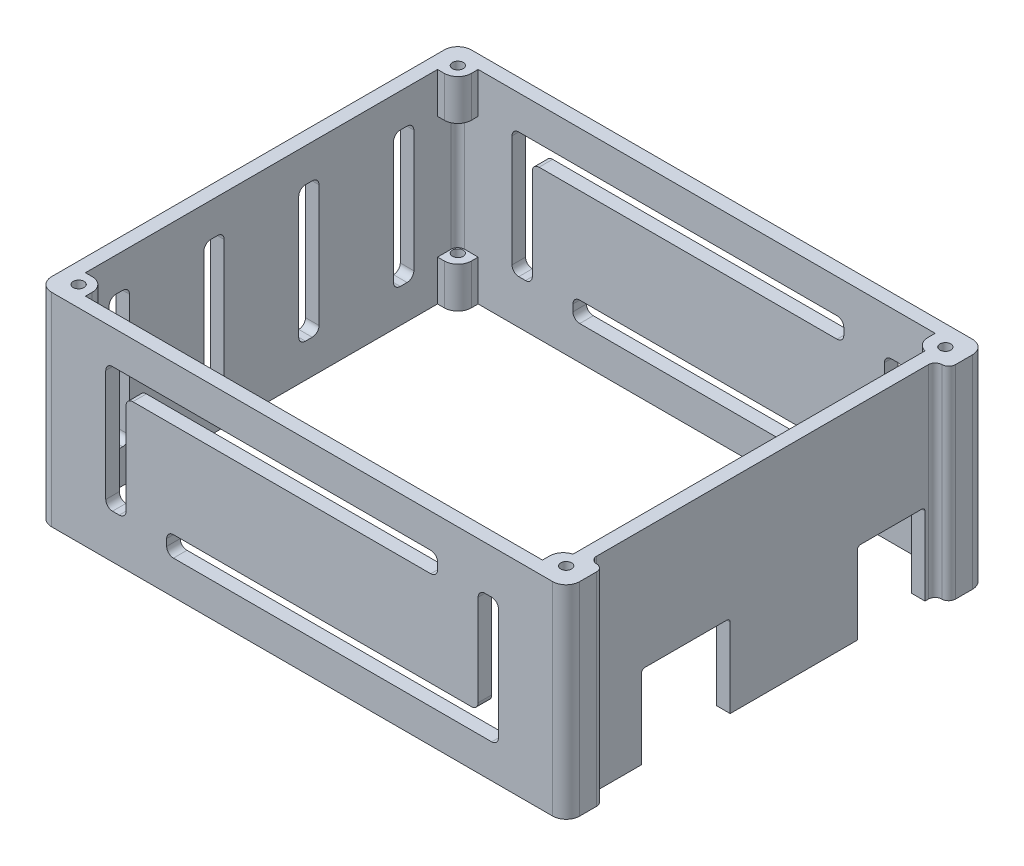
from build123d import *

# Parameters (mm, degrees)
SKETCH4_W             = 72
SKETCH4_H             = 58
BOSS_EXTRUDE3_DEPTH   = 30
SKETCH5_W             = 13.1
SKETCH5_H             = 12.2
SKETCH5_W_2           = 10
SKETCH5_H_2           = 12
CUT_EXTRUDE2_DEPTH    = 13
CUT_EXTRUDE4_REACH    = 91.135
CUT_EXTRUDE3_DEPTH    = 80.649231007
SKETCH21_W            = 3
SKETCH21_H            = 3
SKETCH21_W_2          = 1.5
BOSS_EXTRUDE5_DEPTH   = 6
M2_TAPPED_HOLE1_D     = 1.6
M2_TAPPED_HOLE1_DEPTH = 30
FILLET1_R             = 1
FILLET4_R             = 0.5
FILLET5_R             = 2


# Some blends are built 0.0001 mm under size
with BuildPart() as part:
    # Sketch4 → Boss-Extrude3 (new body)
    with BuildSketch(Plane(origin=(0, 0, 0), x_dir=(1, 0, 0), z_dir=(0, 1, 0))):
        Polygon((-38, -31), (40, -31), (40, -25.5), (38, -25.5), (38, 25.5), (40, 25.5), (40, 31), (-38, 31), align=None)
        Rectangle(SKETCH4_W, SKETCH4_H, mode=Mode.SUBTRACT)
    extrude(amount=BOSS_EXTRUDE3_DEPTH)

    # Sketch5 → Cut-Extrude2 (cut)
    with BuildSketch(Plane(origin=(38, 0, 0), x_dir=(0, 0, -1), z_dir=(1, 0, 0))):
        with Locations((-11.33, 6.1)):
            Rectangle(SKETCH5_W, SKETCH5_H)
        with Locations((19, 6)):
            Rectangle(SKETCH5_W_2, SKETCH5_H_2)
    extrude(amount=-CUT_EXTRUDE2_DEPTH, mode=Mode.SUBTRACT)

    # Sketch15 → Cut-Extrude4 (cut, up to next)
    with BuildSketch(Plane.ZY.offset(38), mode=Mode.PRIVATE) as cut_extrude4_sk1:
        with BuildLine():
            Line((-21.5, 25), (-20.5, 25))
            ThreePointArc((-20.5, 25), (-19.792893219, 24.707106781), (-19.5, 24))
            Line((-19.5, 24), (-19.5, 6))
            ThreePointArc((-19.5, 6), (-19.792893219, 5.292893219), (-20.5, 5))
            Line((-20.5, 5), (-21.5, 5))
            ThreePointArc((-21.5, 5), (-22.207106781, 5.292893219), (-22.5, 6))
            Line((-22.5, 6), (-22.5, 24))
            ThreePointArc((-22.5, 24), (-22.207106781, 24.707106781), (-21.5, 25))
        make_face()
    cut_extrude4_tool1 = extrude(cut_extrude4_sk1.sketch, amount=-CUT_EXTRUDE4_REACH, mode=Mode.PRIVATE) & part.part
    # Sketch15 → Cut-Extrude4 (cut, up to next)
    with BuildSketch(Plane.ZY.offset(38), mode=Mode.PRIVATE) as cut_extrude4_sk2:
        with BuildLine():
            Line((-7.5, 25), (-6.5, 25))
            ThreePointArc((-6.5, 25), (-5.792893219, 24.707106781), (-5.5, 24))
            Line((-5.5, 24), (-5.5, 6))
            ThreePointArc((-5.5, 6), (-5.792893219, 5.292893219), (-6.5, 5))
            Line((-6.5, 5), (-7.5, 5))
            ThreePointArc((-7.5, 5), (-8.207106781, 5.292893219), (-8.5, 6))
            Line((-8.5, 6), (-8.5, 24))
            ThreePointArc((-8.5, 24), (-8.207106781, 24.707106781), (-7.5, 25))
        make_face()
    cut_extrude4_tool2 = extrude(cut_extrude4_sk2.sketch, amount=-CUT_EXTRUDE4_REACH, mode=Mode.PRIVATE) & part.part
    cut_extrude4_1 = cut_extrude4_tool1.solids().sort_by_distance((-38, 15, -21))[0]
    add(cut_extrude4_1, mode=Mode.SUBTRACT)
    cut_extrude4_2 = cut_extrude4_tool2.solids().sort_by_distance((-38, 15, -7))[0]
    add(cut_extrude4_2, mode=Mode.SUBTRACT)
    cut_extrude4 = cut_extrude4_1 + cut_extrude4_2  # Cut-Extrude4 as one shape, for the pattern or mirror that repeats it

    # Mirror1: Cut-Extrude4 across plane
    add(cut_extrude4.mirror(Plane.XY), mode=Mode.SUBTRACT)

    # Sketch14 → Cut-Extrude3 (cut, through all)
    with BuildSketch(Plane.XY.offset(-31)):
        with BuildLine():
            Line((-28, 7.5), (-28, 24))
            ThreePointArc((-28, 24), (-27.707106781, 24.707106781), (-27, 25))
            Line((-27, 25), (20, 25))
            ThreePointArc((20, 25), (20.707106781, 24.707106781), (21, 24))
            Line((21, 24), (21, 23))
            ThreePointArc((21, 23), (20.707106781, 22.292893219), (20, 22))
            Line((20, 22), (-24, 22))
            ThreePointArc((-24, 22), (-24.707106781, 21.707106781), (-25, 21))
            Line((-25, 21), (-25, 7.5))
            ThreePointArc((-25, 7.5), (-25.292893219, 6.792893219), (-26, 6.5))
            Line((-26, 6.5), (-27, 6.5))
            ThreePointArc((-27, 6.5), (-27.707106781, 6.792893219), (-28, 7.5))
        make_face()
        with BuildLine():
            Line((27, 22.5), (27, 9))
            ThreePointArc((27, 9), (26.707106781, 8.292893219), (26, 8))
            Line((26, 8), (-18, 8))
            ThreePointArc((-18, 8), (-18.707106781, 7.707106781), (-19, 7))
            Line((-19, 7), (-19, 6))
            ThreePointArc((-19, 6), (-18.707106781, 5.292893219), (-18, 5))
            Line((-18, 5), (29, 5))
            ThreePointArc((29, 5), (29.707106781, 5.292893219), (30, 6))
            Line((30, 6), (30, 22.5))
            ThreePointArc((30, 22.5), (29.707106781, 23.207106781), (29, 23.5))
            Line((29, 23.5), (28, 23.5))
            ThreePointArc((28, 23.5), (27.292893219, 23.207106781), (27, 22.5))
        make_face()
    extrude(amount=CUT_EXTRUDE3_DEPTH, mode=Mode.SUBTRACT)

    # Sketch21 → Boss-Extrude5 (add)
    with BuildSketch(Plane.XZ):
        with Locations((-34.5, 27.5)):
            Rectangle(SKETCH21_W, SKETCH21_H)
        with Locations((35.25, 27.5)):
            Rectangle(SKETCH21_W_2, SKETCH21_H)
        with Locations((35.25, -27.5)):
            Rectangle(SKETCH21_W_2, SKETCH21_H)
        with Locations((-34.5, -27.5)):
            Rectangle(SKETCH21_W, SKETCH21_H)
    boss_extrude5 = extrude(amount=-BOSS_EXTRUDE5_DEPTH)

    # M2 Tapped Hole1
    with Locations(Plane(origin=(0, 0, 0), x_dir=(-1, 0, 0), z_dir=(0, -1, 0))):
        with Locations((35, 28), (35, -28), (-37, -28), (-37, 28)):
            m2_tapped_hole1 = Hole(M2_TAPPED_HOLE1_D / 2, depth=M2_TAPPED_HOLE1_DEPTH)

    # Fillet1
    fillet1_edges = [part.edges().sort_by_distance(p)[0] for p in [
        (-36, 18, 29),
        (-36, 18, -29),
        (36, 18, 29),
        (36, 18, -29),
        (40, 15, -25.5),
        (38, 15, -25.5),
        (38, 15, 25.5),
        (40, 15, 25.5),
    ]]
    fillet(fillet1_edges, radius=FILLET1_R - 0.0001)  # a hair under: the kernel refuses the full size

    # Fillet4
    fillet4_edges = [part.edges().sort_by_distance(p)[0] for p in [
        (37, 12.2, 4.78),
        (37, 12.2, 17.88),
        (37, 12, -24),
        (37, 12, -14),
    ]]
    fillet(fillet4_edges, radius=FILLET4_R)

    # Mirror2: Boss-Extrude5, M2 Tapped Hole1 across plane
    add(boss_extrude5.mirror(Plane(origin=(0, 15, 0), x_dir=(0, 0, 1), z_dir=(0, -1, 0))))
    add(m2_tapped_hole1.mirror(Plane(origin=(0, 15, 0), x_dir=(0, 0, 1), z_dir=(0, -1, 0))), mode=Mode.SUBTRACT)

    # Fillet5
    # the kernel refuses this fillet: 2 mm, written as the material it takes off along each edge
    with BuildSketch(Plane(origin=(40, -5, 31), x_dir=(-1, 0, 0), z_dir=(0, 1, 0)), Plane(origin=(-38, -5, 31), x_dir=(0, 0, -1), z_dir=(0, 1, 0)), Plane(origin=(-38, -5, -31), x_dir=(1, 0, 0), z_dir=(0, 1, 0)), Plane(origin=(40, -5, -31), x_dir=(0, 0, 1), z_dir=(0, 1, 0))) as fillet5_piece_1:
        with BuildLine():
            CenterArc((FILLET5_R, -FILLET5_R), FILLET5_R, 90, 90)
            Line((0, -FILLET5_R), (-FILLET5_R * 0.02, -FILLET5_R))
            Line((-FILLET5_R * 0.02, -FILLET5_R), (-FILLET5_R * 0.02, FILLET5_R * 0.02))
            Line((-FILLET5_R * 0.02, FILLET5_R * 0.02), (FILLET5_R, FILLET5_R * 0.02))
            Line((FILLET5_R, FILLET5_R * 0.02), (FILLET5_R, 0))
        make_face()
    extrude(amount=40, mode=Mode.SUBTRACT)
    with BuildSketch(Plane(origin=(-33, -5, 26), x_dir=(-1, 0, 0), z_dir=(0, 1, 0)), Plane(origin=(-33, -5, -26), x_dir=(0, 0, -1), z_dir=(0, 1, 0)), Plane(origin=(-33, 35, -26), x_dir=(-1, 0, 0), z_dir=(0, -1, 0))) as fillet5_piece_2:
        with BuildLine():
            CenterArc((FILLET5_R, FILLET5_R), FILLET5_R, 180, 90)
            Line((0, FILLET5_R), (-FILLET5_R * 0.02, FILLET5_R))
            Line((-FILLET5_R * 0.02, FILLET5_R), (-FILLET5_R * 0.02, -FILLET5_R * 0.02))
            Line((-FILLET5_R * 0.02, -FILLET5_R * 0.02), (FILLET5_R, -FILLET5_R * 0.02))
            Line((FILLET5_R, -FILLET5_R * 0.02), (FILLET5_R, 0))
        make_face()
    extrude(amount=16, mode=Mode.SUBTRACT)
    with BuildSketch(Plane(origin=(34.5, -4.841229183, 26), x_dir=(1, 0, 0), z_dir=(0, 1, 0))) as fillet5_piece_3:
        with BuildLine():
            CenterArc((2, -1.936491673), FILLET5_R, 104.477512186, 75.522487814)
            Line((0, -1.936491673), (-0.04, -1.936491673))
            Line((-0.04, -1.936491673), (-0.04, 0))
            Line((-0.04, 0), (0, 0.04))
            ThreePointArc((0, 0.04), (0.75, 0.04), (1.49, 0.038729833))
            Line((1.49, 0.038729833), (1.5, 0))
        make_face()
    extrude(amount=15.682458366, mode=Mode.SUBTRACT)
    with BuildSketch(Plane(origin=(34.5, -4.841229183, -26), x_dir=(1, 0, 0), z_dir=(0, 1, 0))) as fillet5_piece_4:
        with BuildLine():
            CenterArc((2, 1.936491673), FILLET5_R, 180, 75.522487814)
            Line((0, 1.936491673), (-0.04, 1.936491673))
            Line((-0.04, 1.936491673), (-0.04, 0))
            Line((-0.04, 0), (0, -0.04))
            ThreePointArc((0, -0.04), (0.75, -0.04), (1.49, -0.038729833))
            Line((1.49, -0.038729833), (1.5, 0))
        make_face()
    extrude(amount=15.682458366, mode=Mode.SUBTRACT)
    with BuildSketch(Plane(origin=(-33, 35, 26), x_dir=(-1, 0, 0), z_dir=(0, -1, 0))) as fillet5_piece_5:
        with BuildLine():
            CenterArc((FILLET5_R, -FILLET5_R), FILLET5_R, 90, 90)
            Line((0, -FILLET5_R), (-FILLET5_R * 0.02, -FILLET5_R))
            Line((-FILLET5_R * 0.02, -FILLET5_R), (-FILLET5_R * 0.02, FILLET5_R * 0.02))
            Line((-FILLET5_R * 0.02, FILLET5_R * 0.02), (FILLET5_R, FILLET5_R * 0.02))
            Line((FILLET5_R, FILLET5_R * 0.02), (FILLET5_R, 0))
        make_face()
    extrude(amount=16, mode=Mode.SUBTRACT)
    with BuildSketch(Plane(origin=(34.5, 34.841229183, 26), x_dir=(0, 0, 1), z_dir=(0, -1, 0))) as fillet5_piece_6:
        with BuildLine():
            CenterArc((1.936491673, -2), FILLET5_R, 90, 75.522487814)
            Line((0, -1.5), (-0.038729833, -1.49))
            ThreePointArc((-0.038729833, -1.49), (-0.04, -0.75), (-0.04, 0))
            Line((-0.04, 0), (0, 0.04))
            Line((0, 0.04), (1.936491673, 0.04))
            Line((1.936491673, 0.04), (1.936491673, 0))
        make_face()
    extrude(amount=15.682458366, mode=Mode.SUBTRACT)
    with BuildSketch(Plane(origin=(34.5, 34.841229183, -26), x_dir=(0, 0, -1), z_dir=(0, -1, 0))) as fillet5_piece_7:
        with BuildLine():
            CenterArc((1.936491673, 2), FILLET5_R, 194.477512186, 75.522487814)
            Line((0, 1.5), (-0.038729833, 1.49))
            ThreePointArc((-0.038729833, 1.49), (-0.04, 0.75), (-0.04, 0))
            Line((-0.04, 0), (0, -0.04))
            Line((0, -0.04), (1.936491673, -0.04))
            Line((1.936491673, -0.04), (1.936491673, 0))
        make_face()
    extrude(amount=15.682458366, mode=Mode.SUBTRACT)


solid = part.part
